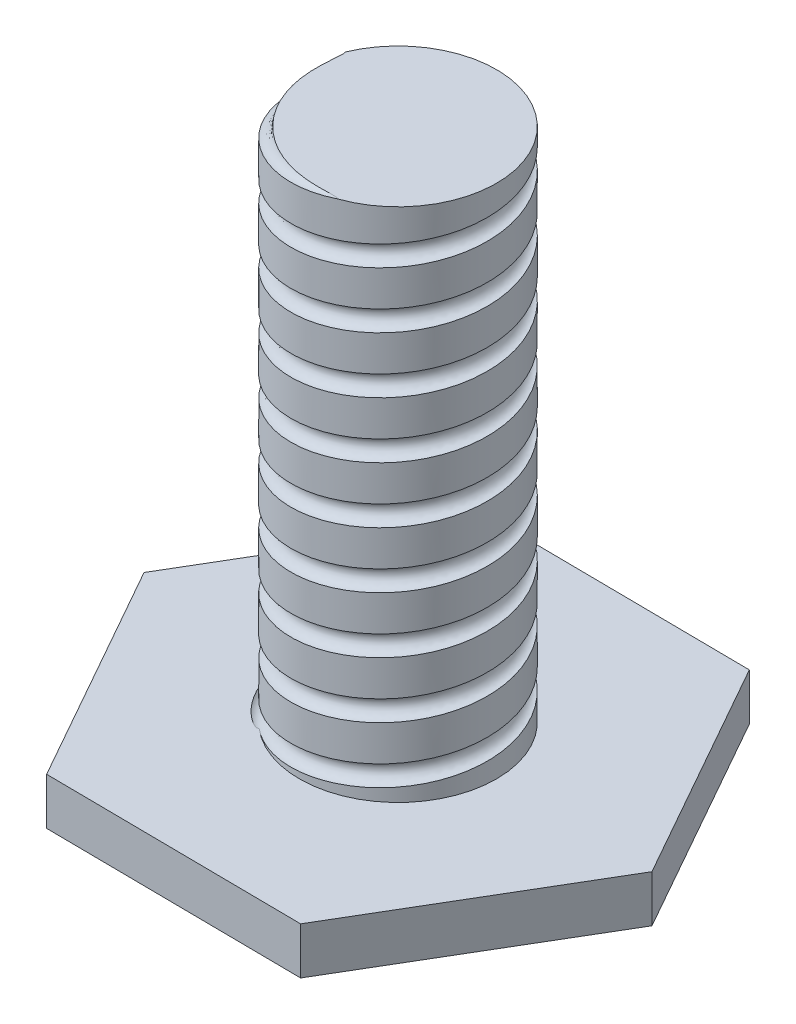
from build123d import *

# Parameters (mm, degrees)
BOSS_EXTRUDE1_DEPTH = 10
SKETCH2_R           = 21.009889288
BOSS_EXTRUDE2_DEPTH = 110
CUT_SWEEP1_PITCH    = 12


with BuildPart() as part:
    # Sketch1 → Boss-Extrude1 (new body)
    with BuildSketch(Plane(origin=(0, 0, 0), x_dir=(1, 0, 0), z_dir=(0, 1, 0))):
        Polygon((26.876231163, -47.644227971), (54.699227348, -0.54661504), (27.822996185, 47.09761293), (-26.876231163, 47.644227971), (-54.699227348, 0.54661504), (-27.822996185, -47.09761293), align=None)
    extrude(amount=BOSS_EXTRUDE1_DEPTH)

    # Sketch2 → Boss-Extrude2 (add)
    with BuildSketch(Plane(origin=(0, 10, 0), x_dir=(1, 0, 0), z_dir=(0, 1, 0))):
        with Locations(Location((0, 0, 0), (0, 0, 270))):
            Circle(SKETCH2_R)
    extrude(amount=BOSS_EXTRUDE2_DEPTH)

    # Cut-Sweep1: arcs per turn and ends read off the stored shape
    # Cut-Sweep1: the profile of Sketch5 screwed along a right-hand helix through 10 turns, 16 arcs to a turn; built about Z, then put on its axis
    cut_sweep1_z = Axis((0, 0, 0), (0, 0, 1))
    cut_sweep1_corners = [(18.889272288, 0, -10.55303933), (21.089592813, 0, -12.753359855), (23.289913338, 0, -10.55303933), (21.089592813, 0, -8.352718805)]
    with BuildLine(mode=Mode.PRIVATE) as cut_sweep1_profile:
        ThreePointArc((18.889272288, 0, -10.55303933), (19.533731249, 0, -12.108900894), (21.089592813, 0, -12.753359855))
        ThreePointArc((21.089592813, 0, -12.753359855), (22.645454377, 0, -12.108900894), (23.289913338, 0, -10.55303933))
        ThreePointArc((23.289913338, 0, -10.55303933), (22.645454377, 0, -8.997177766), (21.089592813, 0, -8.352718805))
        ThreePointArc((21.089592813, 0, -8.352718805), (19.533731249, 0, -8.997177766), (18.889272288, 0, -10.55303933))
    cut_sweep1_cap = Face(cut_sweep1_profile.wire())
    cut_sweep1_arcs = [((18.889272288, 0, -10.55303933), (18.889272288, 0, -12.753359855), (21.089592813, 0, -12.753359855), (1, 0.7071067811865476, 1)), ((21.089592813, 0, -12.753359855), (23.289913338, 0, -12.753359855), (23.289913338, 0, -10.55303933), (1, 0.7071067811865476, 1)), ((23.289913338, 0, -10.55303933), (23.289913338, 0, -8.352718805), (21.089592813, 0, -8.352718805), (1, 0.7071067811865476, 1)), ((21.089592813, 0, -8.352718805), (18.889272288, 0, -8.352718805), (18.889272288, 0, -10.55303933), (1, 0.7071067811865476, 1))]  # start, shoulder, end, weights
    cut_sweep1_turn_angles = [0, 11.25, 22.5, 33.75, 45, 56.25, 67.5, 78.75, 90, 101.25, 112.5, 123.75, 135, 146.25, 157.5, 168.75, 180, 191.25, 202.5, 213.75, 225, 236.25, 247.5, 258.75, 270, 281.25, 292.5, 303.75, 315, 326.25, 337.5, 348.75, 360]
    cut_sweep1_turn_weights = [1, 0.9807852804032304, 1, 0.9807852804032304, 1, 0.9807852804032304, 1, 0.9807852804032304, 1, 0.9807852804032304, 1, 0.9807852804032304, 1, 0.9807852804032304, 1, 0.9807852804032304, 1, 0.9807852804032304, 1, 0.9807852804032304, 1, 0.9807852804032304, 1, 0.9807852804032304, 1, 0.9807852804032304, 1, 0.9807852804032304, 1, 0.9807852804032304, 1, 0.9807852804032304, 1]
    cut_sweep1_turn_sides = [Face.make_bezier_surface([[Vector(p[j][0], p[j][1], 0).rotate(cut_sweep1_z, cut_sweep1_turn_angles[2 * i + k]) / cut_sweep1_turn_weights[2 * i + k] + Vector(0, 0, p[j][2] + CUT_SWEEP1_PITCH * cut_sweep1_turn_angles[2 * i + k] / 360) for k in range(3)] for j in range(3)], [[p[3][j] * cut_sweep1_turn_weights[2 * i + k] for k in range(3)] for j in range(3)]) for p in cut_sweep1_arcs for i in range(16)]
    cut_sweep1 = Plane(origin=(0, 120, 0), x_dir=(-1, 0, 0), z_dir=(0, -1, 0)) * Solid(Shell([*[p.moved(Location((0, 0, CUT_SWEEP1_PITCH * i))) for i in range(10) for p in cut_sweep1_turn_sides], cut_sweep1_cap, cut_sweep1_cap.rotate(cut_sweep1_z, 3600).moved(Location((0, 0, CUT_SWEEP1_PITCH * 3600 / 360)))]))
    add(cut_sweep1, mode=Mode.SUBTRACT)


solid = part.part
